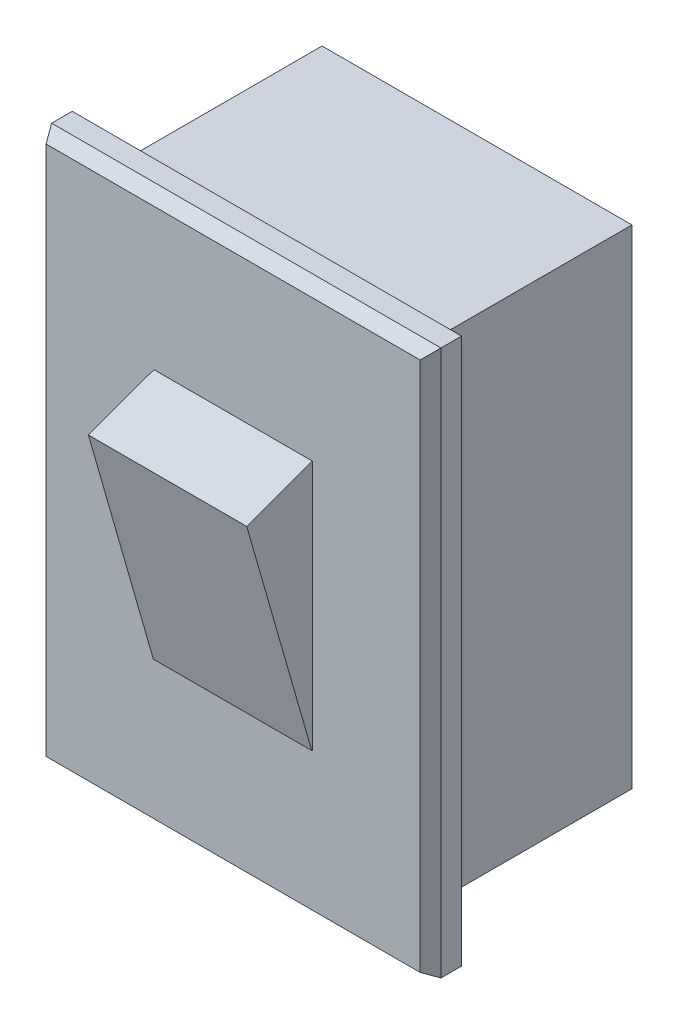
from build123d import *
from OCP.BRepFilletAPI import BRepFilletAPI_MakeChamfer

# Parameters (mm, degrees)
SKETCH_1_W       = 14.75
SKETCH_1_H       = 20.67
EXTRUDE_1_DEPTH  = 1.28
EXTRUDE_2_DEPTH  = 3
CHAMFER_3_SIZE   = 2
CHAMFER_3_SIZE_2 = 11.342563639
CHAMFER_4_SIZE   = 0.5
CHAMFER_4_SIZE2  = 0.288675135
CHAMFER_5_SIZE   = 3
CHAMFER_5_SIZE_2 = 1.041889066
CHAMFER_6_SIZE   = 0.978668112
CHAMFER_6_SIZE_2 = 9
SKETCH_3_W       = 11.74
SKETCH_3_H       = 18.5
EXTRUDE_3_DEPTH  = 7.96


with BuildPart() as part:
    # 草图1 → 凸台-拉伸1 (new body)
    with BuildSketch(Plane.XY):
        Rectangle(SKETCH_1_W, SKETCH_1_H)
    extrude(amount=EXTRUDE_1_DEPTH)

    # 草图2 → 凸台-拉伸2 (add)
    with BuildSketch(Plane.XY.offset(1.28)):
        Polygon((0, -4.8), (-3, -4.8), (-3, 4.8), (3, 4.8), (3, -4.8), align=None)
    extrude(amount=EXTRUDE_2_DEPTH)

    # 倒角3
    # the kernel refuses this chamfer: 11.342563639, 2 mm, written as the material it takes off along each edge
    with BuildSketch(Plane(origin=(32.474091667, -4.8, 4.28), x_dir=(0, -0.21013876076743543, -0.9776715712462578), z_dir=(-1, 0, 0))) as chamfer_3_piece_1:
        Polygon((CHAMFER_3_SIZE * 0.977671571246, -CHAMFER_3_SIZE * 0.210138760767), (-CHAMFER_3_SIZE_2 * 0.210138760772, -CHAMFER_3_SIZE_2 * 0.977671571267), (0, 0), align=None)
    extrude(amount=64.948183335, mode=Mode.SUBTRACT)

    # 倒角4: one chamfer whose edges measure the first distance from different faces: ONE call of the kernel's chamfer builder (chamfer() names one face for all edges)
    chamfer_4_edges_1 = [part.edges().sort_by_distance(p)[0] for p in [
        (7.375, 0, 1.28),
    ]]
    chamfer_4_side_1 = [part.faces().sort_by_distance(p)[0] for p in [
        (7.375, 0, 0.64),
    ]]
    chamfer_4_edges_2 = [part.edges().sort_by_distance(p)[0] for p in [
        (0, 10.335, 1.28),
    ]]
    chamfer_4_side_2 = [part.faces().sort_by_distance(p)[0] for p in [
        (0, 10.335, 0.64),
    ]]
    chamfer_4_edges_3 = [part.edges().sort_by_distance(p)[0] for p in [
        (-7.375, 0, 1.28),
    ]]
    chamfer_4_side_3 = [part.faces().sort_by_distance(p)[0] for p in [
        (-7.375, 0, 0.64),
    ]]
    chamfer_4_edges_4 = [part.edges().sort_by_distance(p)[0] for p in [
        (0, -10.335, 1.28),
    ]]
    chamfer_4_side_4 = [part.faces().sort_by_distance(p)[0] for p in [
        (0, -10.335, 0.64),
    ]]
    chamfer_4 = BRepFilletAPI_MakeChamfer(part.part.solid().wrapped)
    for e in chamfer_4_edges_1:
        chamfer_4.Add(CHAMFER_4_SIZE, CHAMFER_4_SIZE2, e.wrapped, chamfer_4_side_1[0].wrapped)  # the first distance lies on this face
    for e in chamfer_4_edges_2:
        chamfer_4.Add(CHAMFER_4_SIZE, CHAMFER_4_SIZE2, e.wrapped, chamfer_4_side_2[0].wrapped)  # the first distance lies on this face
    for e in chamfer_4_edges_3:
        chamfer_4.Add(CHAMFER_4_SIZE, CHAMFER_4_SIZE2, e.wrapped, chamfer_4_side_3[0].wrapped)  # the first distance lies on this face
    for e in chamfer_4_edges_4:
        chamfer_4.Add(CHAMFER_4_SIZE, CHAMFER_4_SIZE2, e.wrapped, chamfer_4_side_4[0].wrapped)  # the first distance lies on this face
    add(Compound.cast(chamfer_4.Shape()), mode=Mode.REPLACE)

    # 倒角5
    # the kernel refuses this chamfer: 3, 1.041889066 mm, written as the material it takes off along each edge
    with BuildSketch(Plane(origin=(10.782584198, 4.8, 3.972739015), x_dir=(0, 0.013184058198646008, -0.9999130865277315), z_dir=(-1, 0, 0))) as chamfer_5_piece_1_section:
        Polygon((CHAMFER_5_SIZE * 0.999913086528, CHAMFER_5_SIZE * 0.0131840581986), (CHAMFER_5_SIZE_2 * 0.160649322571, CHAMFER_5_SIZE_2 * 0.987011547633), (0, 0), align=None)
    chamfer_5_piece_1 = extrude(amount=21.565168395, mode=Mode.PRIVATE)
    chamfer_5_piece_1 = split(chamfer_5_piece_1, bisect_by=Plane(origin=(0, 4.454539571, 1.28), z_dir=(0, 0, 1)), keep=Keep.TOP, mode=Mode.PRIVATE)
    add(chamfer_5_piece_1, mode=Mode.SUBTRACT)

    # 倒角6
    # the kernel refuses this chamfer: 9, 0.978668112 mm, written as the material it takes off along each edge
    with BuildSketch(Plane(origin=(26.395258852, -4.8, 2.28), x_dir=(0, -0.30567862025886394, -0.952134749453373), z_dir=(-1, 0, 0))) as chamfer_6_piece_1:
        Polygon((CHAMFER_6_SIZE * 0.952134749764, -CHAMFER_6_SIZE * 0.305678620359), (-CHAMFER_6_SIZE_2 * 0.466371139297, -CHAMFER_6_SIZE_2 * 0.884589147814), (0, 0), align=None)
    extrude(amount=52.790517704, mode=Mode.SUBTRACT)

    # 草图3 → 凸台-拉伸3 (add)
    with BuildSketch(Plane(origin=(0, 0, 0), x_dir=(-1, 0, 0), z_dir=(0, 0, -1))):
        Rectangle(SKETCH_3_W, SKETCH_3_H)
    extrude(amount=EXTRUDE_3_DEPTH)


solid = part.part
